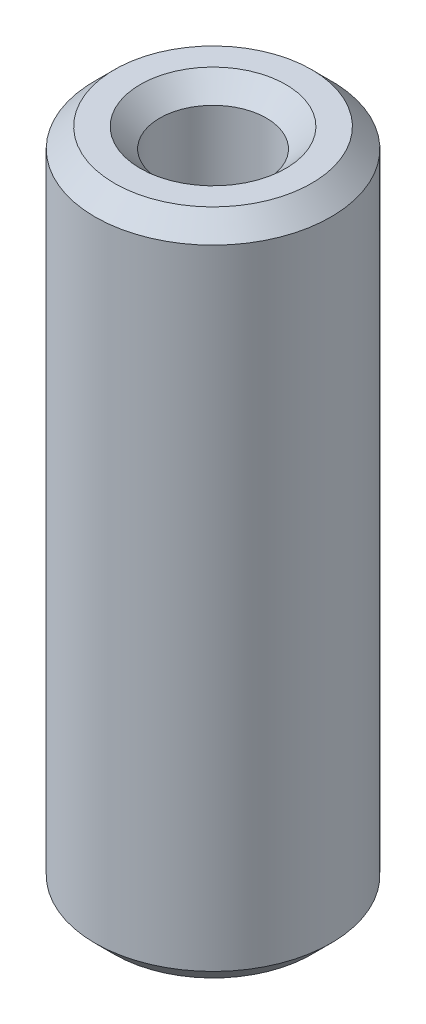
from build123d import *

# Parameters (mm, degrees)
SKETCH1_R           = 22.5
BOSS_EXTRUDE1_DEPTH = 127.36261781
SKETCH2_R           = 10.175503952
CUT_EXTRUDE1_DEPTH  = 132.277326357
CHAMFER1_SIZE       = 3.701265602


with BuildPart() as part:
    # Sketch1 → Boss-Extrude1 (new body)
    with BuildSketch(Plane(origin=(0, 0, 0), x_dir=(1, 0, 0), z_dir=(0, 1, 0))):
        Circle(SKETCH1_R)
    extrude(amount=BOSS_EXTRUDE1_DEPTH)

    # Sketch2 → Cut-Extrude1 (cut, through all)
    with BuildSketch(Plane(origin=(0, 0, 0), x_dir=(1, 0, 0), z_dir=(0, 1, 0))):
        Circle(SKETCH2_R)
    extrude(amount=CUT_EXTRUDE1_DEPTH, mode=Mode.SUBTRACT)

    # Chamfer1
    chamfer1_edges = [part.edges().sort_by_distance(p)[0] for p in [
        (-10.175503952, 127.36261781, 0),
        (-10.175503952, 0, 0),
        (-22.5, 0, 0),
        (-22.5, 127.36261781, 0),
    ]]
    chamfer(chamfer1_edges, length=CHAMFER1_SIZE)


solid = part.part
